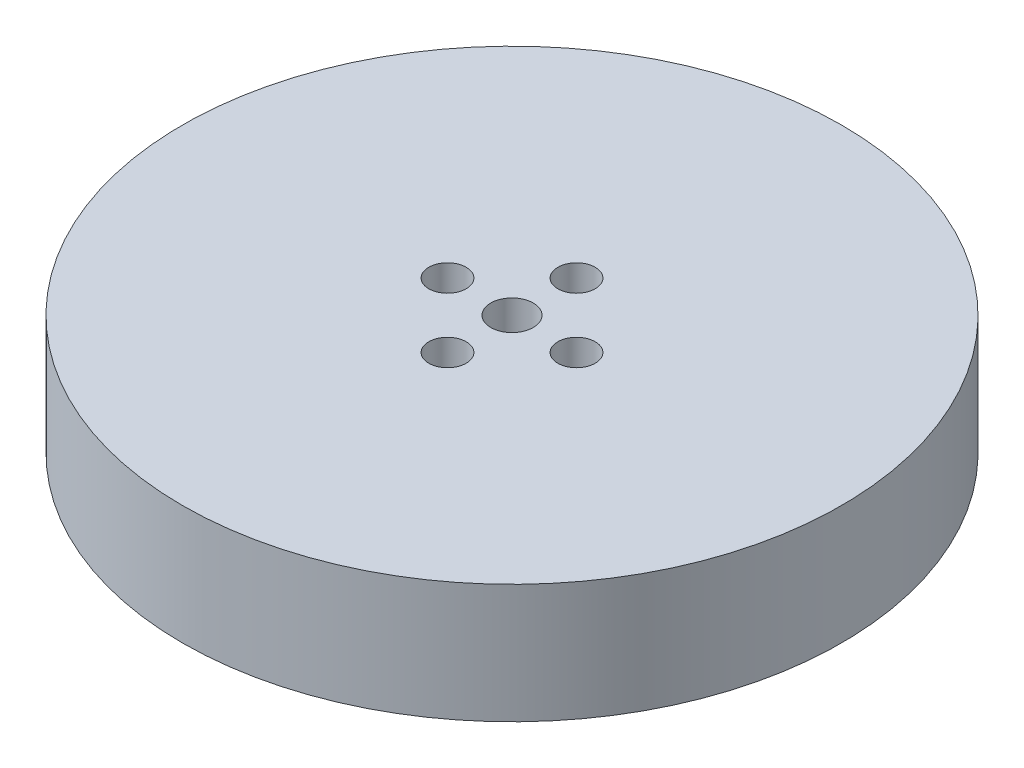
from build123d import *

# Parameters (mm, degrees)
SKETCH1_R           = 77.5
BOSS_EXTRUDE1_DEPTH = 28
SKETCH2_R           = 5
CUT_EXTRUDE1_DEPTH  = 114.121615971
SKETCH3_R           = 4.393814525
CUT_EXTRUDE2_DEPTH  = 20.589767576
CIRPATTERN1_COUNT   = 4


with BuildPart() as part:
    # Sketch1 → Boss-Extrude1 (new body)
    with BuildSketch(Plane(origin=(0, 0, 0), x_dir=(1, 0, 0), z_dir=(0, 1, 0))):
        Circle(SKETCH1_R)
    extrude(amount=BOSS_EXTRUDE1_DEPTH)

    # Sketch2 → Cut-Extrude1 (cut, through all)
    with BuildSketch(Plane(origin=(0, 0, 0), x_dir=(1, 0, 0), z_dir=(0, 1, 0))):
        Circle(SKETCH2_R)
    extrude(amount=CUT_EXTRUDE1_DEPTH, mode=Mode.SUBTRACT)

    # Sketch3 → Cut-Extrude2 (cut)
    with BuildSketch(Plane(origin=(0, 28, 0), x_dir=(1, 0, 0), z_dir=(0, 1, 0))):
        with Locations((-15.170338167, 0)):
            Circle(SKETCH3_R)
    cut_extrude2 = extrude(amount=-CUT_EXTRUDE2_DEPTH, mode=Mode.SUBTRACT)

    # CirPattern1: Cut-Extrude2 ×4 about axis
    cirpattern1_axis = Axis((0, 0, 0), (0, 1, 0))
    for i in range(1, CIRPATTERN1_COUNT):
        add(cut_extrude2.rotate(cirpattern1_axis, i * 360 / CIRPATTERN1_COUNT), mode=Mode.SUBTRACT)


solid = part.part
